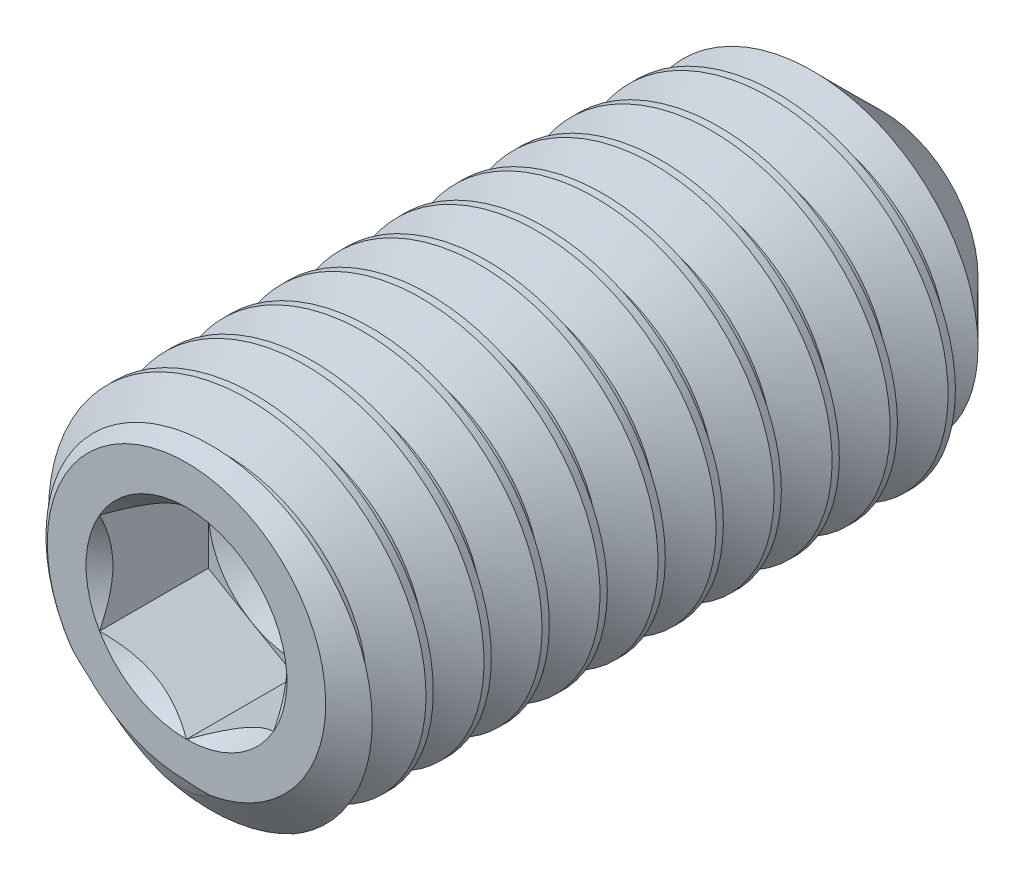
from build123d import *

# Parameters (mm, degrees)
CUT_SWEEP2_PITCH    = 0.5
CUT_EXTRUDE10_DEPTH = 0.9375


with BuildPart() as part:
    # Sketch22 → Revolve1 (revolve)
    with BuildSketch(Plane(origin=(0, 0, 0), x_dir=(0, 0, -1), z_dir=(1, 0, 0)), mode=Mode.PRIVATE) as revolve1_sk:
        Polygon((-2.7530621, 0), (-2.7530621, 1.2), (-2.542999839, 1.5), (2.568885259, 1.5), (3.2469379, 0.821947359), (2.7530621, 0), align=None)
    revolve(revolve1_sk.sketch.rotate(Axis((0, 0, -2.7530621), (0, 0, -1)), 180), axis=Axis((0, 0, -2.7530621), (0, 0, -1)))

    # Cut-Sweep2: arcs per turn and ends read off the stored shape
    # Cut-Sweep2: the profile of Sketch28 profile screwed along a right-hand helix through 13 turns, 6 arcs to a turn; built about Z, then put on its axis
    cut_sweep2_z = Axis((0, 0, 0), (0, 0, 1))
    cut_sweep2_corners = [(1.5003, 1.047e-06, -0.124826739), (1.5003, 1.047e-06, -0.56267315), (1.175240474, 8.2e-07, -0.374999944), (1.175240474, 8.2e-07, -0.312499944)]
    with BuildLine(mode=Mode.PRIVATE) as cut_sweep2_profile:
        Line(cut_sweep2_corners[0], cut_sweep2_corners[1])
        Line(cut_sweep2_corners[1], cut_sweep2_corners[2])
        Line(cut_sweep2_corners[2], cut_sweep2_corners[3])
        Line(cut_sweep2_corners[3], cut_sweep2_corners[0])
    cut_sweep2_cap = Face(cut_sweep2_profile.wire())
    cut_sweep2_turn_angles = [0, 30, 60, 90, 120, 150, 180, 210, 240, 270, 300, 330, 360]
    cut_sweep2_turn_weights = [1, 0.8660254037844387, 1, 0.8660254037844387, 1, 0.8660254037844387, 1, 0.8660254037844387, 1, 0.8660254037844387, 1, 0.8660254037844387, 1]
    cut_sweep2_turn_rails = [Edge.make_bspline([Vector(p[0], p[1], 0).rotate(cut_sweep2_z, cut_sweep2_turn_angles[k]) / cut_sweep2_turn_weights[k] + Vector(0, 0, p[2] + CUT_SWEEP2_PITCH * cut_sweep2_turn_angles[k] / 360) for k in range(13)], [0, 0, 0, 1, 1, 2, 2, 3, 3, 4, 4, 5, 5, 6, 6, 6], 2, cut_sweep2_turn_weights) for p in cut_sweep2_corners]
    cut_sweep2_turn_sides = [Face.make_surface_from_curves(cut_sweep2_turn_rails[p[0]], cut_sweep2_turn_rails[p[1]]) for p in [(0, 1), (1, 2), (2, 3), (3, 0)]]
    cut_sweep2 = Plane(origin=(0, 0, -3.2469379), x_dir=(1, 0, 0), z_dir=(0, 0, 1)) * Solid(Shell([*[p.moved(Location((0, 0, CUT_SWEEP2_PITCH * i))) for i in range(13) for p in cut_sweep2_turn_sides], cut_sweep2_cap, cut_sweep2_cap.rotate(cut_sweep2_z, 4680).moved(Location((0, 0, CUT_SWEEP2_PITCH * 4680 / 360)))]))
    add(cut_sweep2, mode=Mode.SUBTRACT)

    # Sketch23 → Cut-Extrude10 (cut)
    with BuildSketch(Plane.XY.offset(2.7530621)):
        Polygon((0, 0.866025404), (-0.75, 0.433012702), (-0.75, -0.433012702), (0, -0.866025404), (0.75, -0.433012702), (0.75, 0.433012702), align=None)
    extrude(amount=-CUT_EXTRUDE10_DEPTH, mode=Mode.SUBTRACT)

    # Cut-Extrude11 cone 1 section (through the dimple's axis) → Cut-Extrude11 (revolve, cut)
    with BuildSketch(Plane(origin=(0, 0, 2.7530621), x_dir=(0, -1, 0), z_dir=(1, 0, 0))):
        Polygon((0, 0), (0.866025404, 0), (0, 0.866025404), align=None)
    revolve(axis=Axis((0, 0, 2.7530621), (0, 0, -1)), mode=Mode.SUBTRACT)

    # Cut-Extrude12 cone 1 section (through the dimple's axis) → Cut-Extrude12 (revolve, cut)
    with BuildSketch(Plane(origin=(0, 0, 1.8155621), x_dir=(0, -1, 0), z_dir=(1, 0, 0))):
        Polygon((0, 0), (0.75, 0), (0, 0.433012702), align=None)
    revolve(axis=Axis((0, 0, 1.8155621), (0, 0, -1)), mode=Mode.SUBTRACT)


solid = part.part
